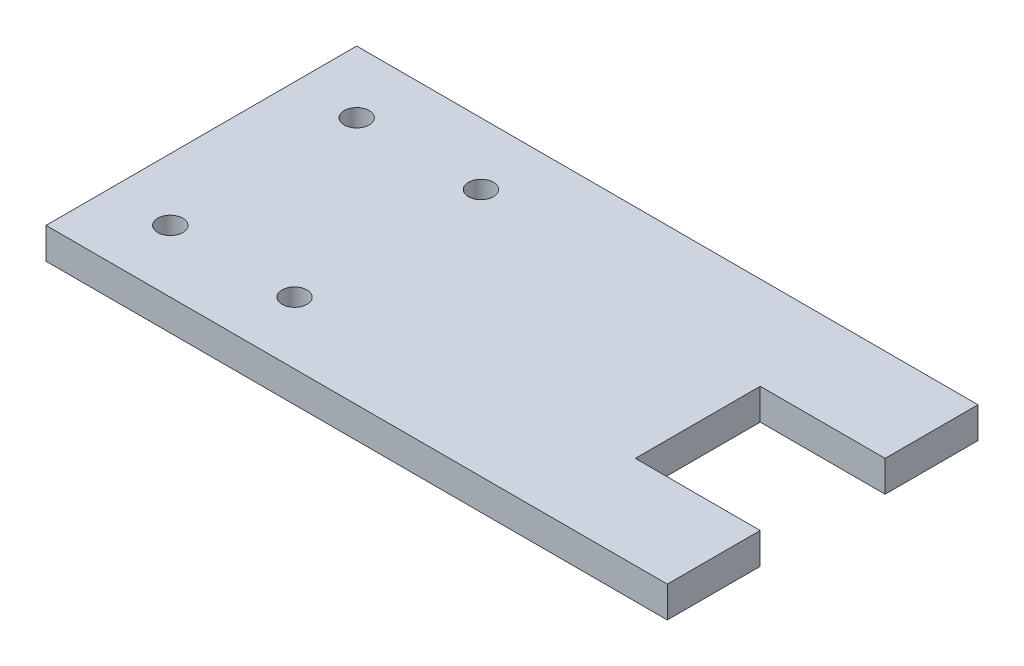
from build123d import *

# Parameters (mm, degrees)
BOSS_EXTRUDE1_DEPTH    = 6.35
F_10_CLEARANCE_HOLE1_D = 5.1054
SKETCH5_W              = 25.527
SKETCH5_H              = 25.527
CUT_EXTRUDE1_DEPTH     = 83.793870546


with BuildPart() as part:
    # Sketch1 → Boss-Extrude1 (new body)
    with BuildSketch(Plane(origin=(0, 0, 0), x_dir=(1, 0, 0), z_dir=(0, 1, 0))):
        Polygon((50.8, 31.75), (76.2, 31.75), (76.2, -31.75), (50.8, -31.75), (-50.8, -31.75), (-50.8, 31.75), align=None)
    extrude(amount=BOSS_EXTRUDE1_DEPTH)

    # #10 Clearance Hole1 (through all)
    with Locations(Plane(origin=(0, 6.35, 0), x_dir=(1, 0, 0), z_dir=(0, 1, 0))):
        with Locations((-38.1, 19.05), (-12.7, 19.05), (-12.7, -19.05), (-38.1, -19.05)):
            Hole(F_10_CLEARANCE_HOLE1_D / 2)

    # Sketch5 → Cut-Extrude1 (cut, through all)
    with BuildSketch(Plane(origin=(0, 6.35, 0), x_dir=(1, 0, 0), z_dir=(0, 1, 0))):
        with Locations((63.4365, 0)):
            Rectangle(SKETCH5_W, SKETCH5_H)
    extrude(amount=-CUT_EXTRUDE1_DEPTH, mode=Mode.SUBTRACT)


solid = part.part
